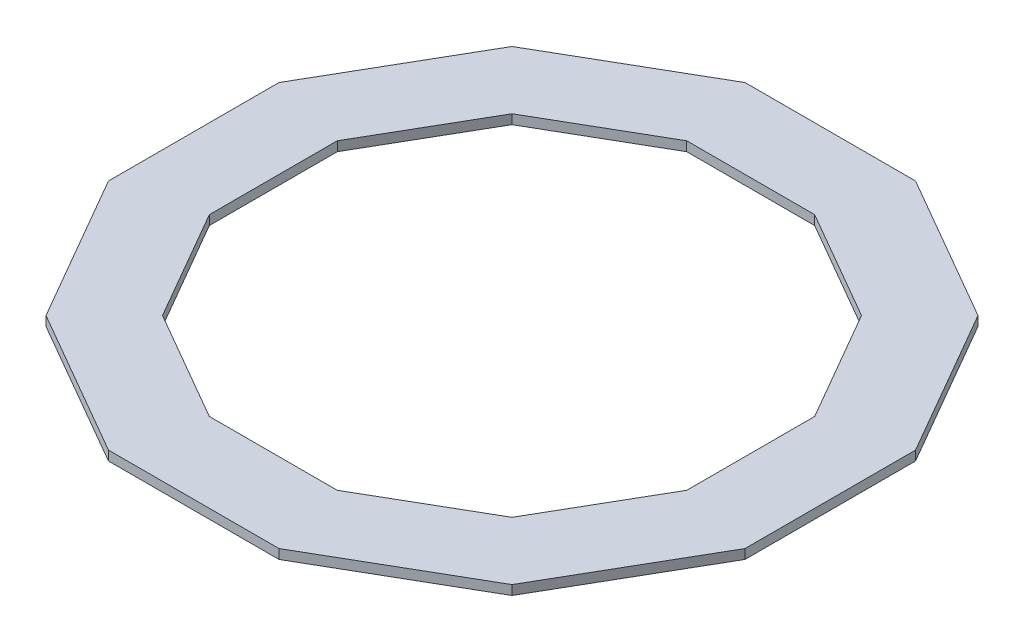
from build123d import *

# Parameters (mm, degrees)
BOSS_EXTRUDE1_DEPTH = 2.921
CUT_EXTRUDE1_DEPTH  = 139.818915977


with BuildPart() as part:
    # Sketch1 → Boss-Extrude1 (new body)
    with BuildSketch(Plane(origin=(0, 0, 0), x_dir=(1, 0, 0), z_dir=(0, 1, 0))):
        Polygon((71.842048969, 71.842048969), (26.296014982, 98.138063951), (-26.296014982, 98.138063951), (-71.842048969, 71.842048969), (-98.138063951, 26.296014982), (-98.138063951, -26.296014982), (-71.842048969, -71.842048969), (-26.296014982, -98.138063951), (26.296014982, -98.138063951), (71.842048969, -71.842048969), (98.138063951, -26.296014982), (98.138063951, 26.296014982), align=None)
    extrude(amount=-BOSS_EXTRUDE1_DEPTH)

    # Sketch3 → Cut-Extrude1 (cut, through all)
    with BuildSketch(Plane(origin=(0, 0, 0), x_dir=(1, 0, 0), z_dir=(0, 1, 0))):
        Polygon((-19.722011237, 73.603547963), (-53.881536726, 53.881536726), (-73.603547963, 19.722011237), (-73.603547963, -19.722011237), (-53.881536726, -53.881536726), (-19.722011237, -73.603547963), (19.722011237, -73.603547963), (53.881536726, -53.881536726), (73.603547963, -19.722011237), (73.603547963, 19.722011237), (53.881536726, 53.881536726), (19.722011237, 73.603547963), align=None)
    extrude(amount=-CUT_EXTRUDE1_DEPTH, mode=Mode.SUBTRACT)


solid = part.part
